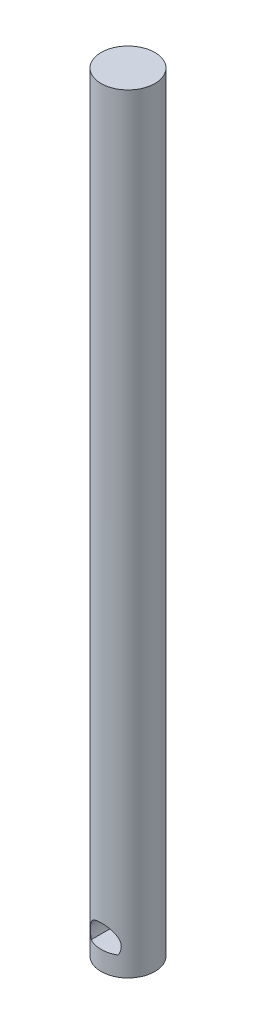
from build123d import *

# Parameters (mm, degrees)
SKETCH1_R           = 3.5
BOSS_EXTRUDE1_DEPTH = 100
CUT_EXTRUDE1_DEPTH  = 4.5
CUT_EXTRUDE2_START  = -2.5
CUT_EXTRUDE2_DEPTH  = 2.5


with BuildPart() as part:
    # Sketch1 → Boss-Extrude1 (new body)
    with BuildSketch(Plane(origin=(0, 0, 0), x_dir=(1, 0, 0), z_dir=(0, 1, 0))):
        Circle(SKETCH1_R)
    extrude(amount=BOSS_EXTRUDE1_DEPTH)

    # Sketch4 → Cut-Extrude1 (cut)
    with BuildSketch(Plane.XY):
        with BuildLine():
            Line((1.732343324, 2.500506818), (-1.732343324, 2.500506818))
            ThreePointArc((-1.732343324, 2.500506818), (0, 5.500000003), (1.732343324, 2.500506818))
        make_face()
    extrude(amount=CUT_EXTRUDE1_DEPTH, mode=Mode.SUBTRACT)

    # Sketch4<4> → Cut-Extrude2 (cut)
    with BuildSketch(Plane.XY.offset(CUT_EXTRUDE2_START)):
        with BuildLine():
            Line((1.732343324, 2.500506818), (-1.732343324, 2.500506818))
            ThreePointArc((-1.732343324, 2.500506818), (0, 5.500000003), (1.732343324, 2.500506818))
        make_face()
    extrude(amount=CUT_EXTRUDE2_DEPTH, mode=Mode.SUBTRACT)


solid = part.part
